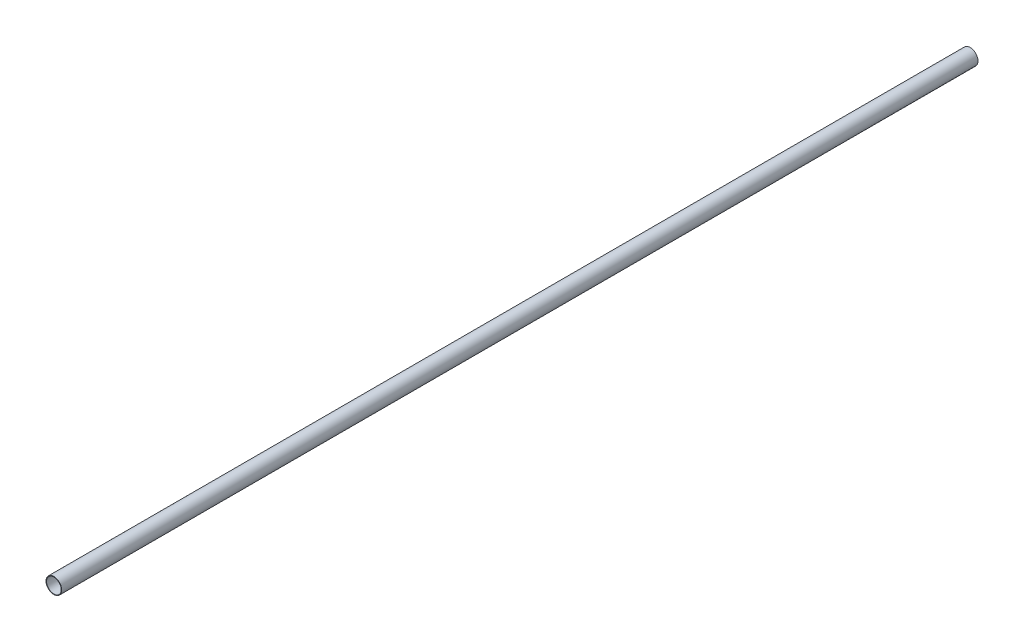
from build123d import *

# Parameters (mm, degrees)
SKETCH_1_R      = 3
SKETCH_1_R_2    = 2.8
EXTRUDE_1_DEPTH = 350


with BuildPart() as part:
    # Эскиз1 → Бобышка-Вытянуть1 (new body)
    with BuildSketch(Plane.XY):
        Circle(SKETCH_1_R)
        Circle(SKETCH_1_R_2, mode=Mode.SUBTRACT)
    extrude(amount=EXTRUDE_1_DEPTH)


solid = part.part
